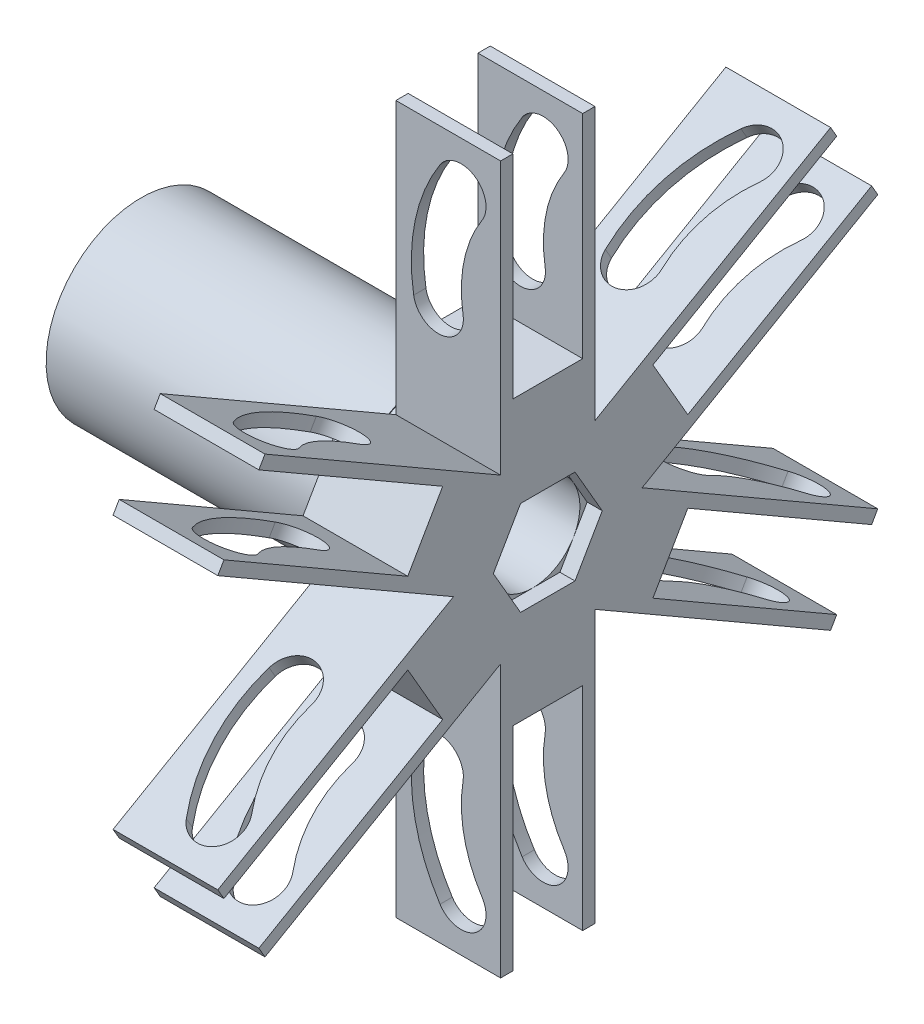
from build123d import *

# Parameters (mm, degrees)
SKETCH_1_R               = 20
EXTRUDE_1_DEPTH          = 10
SKETCH_2_W               = 22.2
SKETCH_2_H               = 65
EXTRUDE_2_DEPTH          = 10
SKETCH_6_W               = 14.8
SKETCH_6_H               = 90
F_14_8MM_DEPTH           = 79.735252587
CUT_EXTRUDE_2_DEPTH      = 10
PATTERN_CIRCULAR_1_COUNT = 6
CUT_EXTRUDE_3_DEPTH      = 104.404589129
CUT_EXTRUDE_3_DEPTH_BACK = 104.404589129
SKETCH_5_R               = 10


# Read off the part's stored shape, not the designer's step: 3与4小孔端融合
with BuildPart() as part:
    # 草图1 → 凸台-拉伸1 (new, symmetric)
    with BuildSketch(Plane(origin=(0, 0, 0), x_dir=(0, 0, -1), z_dir=(1, 0, 0))):
        Circle(SKETCH_1_R)
    extrude(amount=EXTRUDE_1_DEPTH, both=True)

    # 草图2 → 凸台-拉伸2 (add, symmetric)
    with BuildSketch(Plane.XY):
        with Locations((2.1, 42.5)):
            Rectangle(SKETCH_2_W, SKETCH_2_H)
    extrude_2 = extrude(amount=EXTRUDE_2_DEPTH, both=True)

    # 草图6 → 叉口贯穿_14.8mm_稳定基准 (cut, symmetric)
    with BuildSketch(Plane(origin=(0, 0, 0), x_dir=(0, 0, -1), z_dir=(1, 0, 0))):
        with Locations((0, 75)):
            Rectangle(SKETCH_6_W, SKETCH_6_H)
    f_14_8mm = extrude(amount=F_14_8MM_DEPTH, both=True, mode=Mode.SUBTRACT)

    # 草图4 → 切除-拉伸2 (cut, symmetric)
    with BuildSketch(Plane.XY):
        with BuildLine():
            ThreePointArc((0.354791324, 67.87679305), (-4.923683601, 55.030996482), (-5.230806803, 41.146384051))
            ThreePointArc((-5.230806803, 41.146384051), (0.853615949, 36.769193197), (5.230806803, 42.853615949))
            ThreePointArc((5.230806803, 42.853615949), (5.452207774, 52.862845615), (9.257389091, 62.12320695))
            ThreePointArc((9.257389091, 62.12320695), (7.682883257, 69.451298883), (0.354791324, 67.87679305))
        make_face()
    cut_extrude_2 = extrude(amount=CUT_EXTRUDE_2_DEPTH, both=True, mode=Mode.SUBTRACT)

    # 阵列(圆周)1: 凸台-拉伸2, 叉口贯穿_14.8mm_稳定基准, 切除-拉伸2 ×6 about axis
    pattern_circular_1_axis = Axis((0, 0, 0), (1, 0, 0))
    add([extrude_2.rotate(pattern_circular_1_axis, i * 360 / PATTERN_CIRCULAR_1_COUNT) for i in range(1, PATTERN_CIRCULAR_1_COUNT)])
    add([f_14_8mm.rotate(pattern_circular_1_axis, i * 360 / PATTERN_CIRCULAR_1_COUNT) for i in range(1, PATTERN_CIRCULAR_1_COUNT)], mode=Mode.SUBTRACT)
    add([cut_extrude_2.rotate(pattern_circular_1_axis, i * 360 / PATTERN_CIRCULAR_1_COUNT) for i in range(1, PATTERN_CIRCULAR_1_COUNT)], mode=Mode.SUBTRACT)

    # 草图5 → 切除-拉伸3 (cut, two sides: drawn at the far end of the back side and taken through both)
    with BuildSketch(Plane.ZY.offset(-CUT_EXTRUDE_3_DEPTH_BACK)):
        Circle(SKETCH_5_R)
    extrude(amount=CUT_EXTRUDE_3_DEPTH + CUT_EXTRUDE_3_DEPTH_BACK, mode=Mode.SUBTRACT)

    # Combine 3_4 outline → Combine 3_4 (revolve)
    with BuildSketch(Plane.YX):
        Polygon((6.3, -10), (6, -10.3), (6, -12.7), (6.3, -13), (17.15, -13), (17.15, -72.7), (17.45, -73), (20.15, -73), (20.15, -10), align=None)
    revolve(axis=Axis((0, 0, 0), (1, 0, 0)))


solid = part.part
